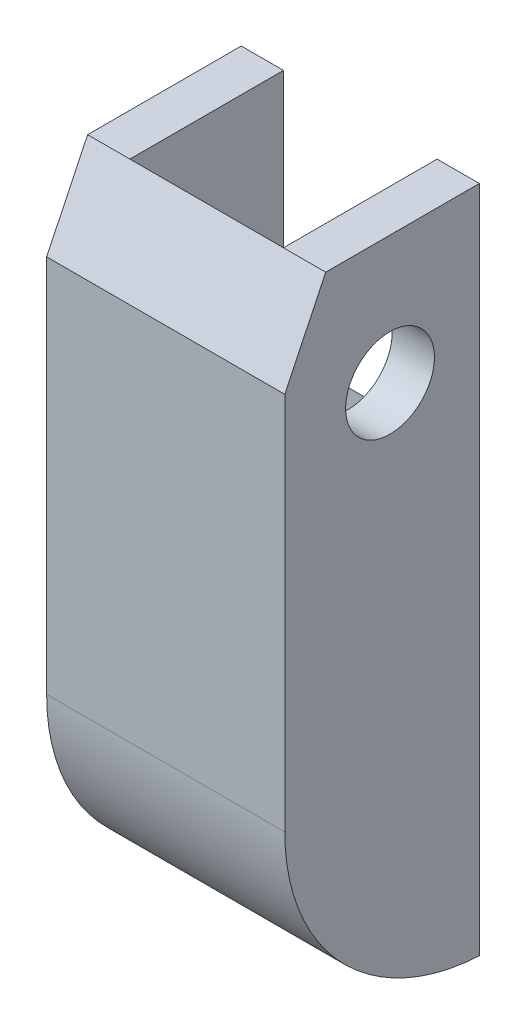
from build123d import *

# Parameters (mm, degrees)
SKETCH1_W               = 11.811
SKETCH1_H               = 45.98924
BOSS_EXTRUDE1_DEPTH     = 9.652
FILLET5_R               = 4.826
SKETCH2_W               = 7.62
SKETCH2_H               = 22.352
CUT_EXTRUDE1_DEPTH      = 7.62
CUT_EXTRUDE2_DEPTH      = 49.452771033
CUT_EXTRUDE2_DEPTH_BACK = 49.452771033
SKETCH3_R               = 2.20345
FILLET4_R               = 4.826
FILLET6_R               = 10.16
CUT_EXTRUDE3_DEPTH      = 49.452771033
CUT_EXTRUDE4_DEPTH      = 7.62
BOSS_EXTRUDE2_DEPTH     = 7.62


with BuildPart() as part:
    # Sketch1 → Boss-Extrude1 (new body)
    with BuildSketch(Plane.XY):
        with Locations((5.9055, 22.99462)):
            Rectangle(SKETCH1_W, SKETCH1_H)
    extrude(amount=BOSS_EXTRUDE1_DEPTH)

    # Fillet5
    fillet5_edges = [part.edges().sort_by_distance(p)[0] for p in [
        (5.9055, 45.98924, 0),
    ]]
    fillet(fillet5_edges, radius=FILLET5_R)

    # Sketch2 → Cut-Extrude1 (cut)
    with BuildSketch(Plane(origin=(0, 0, 0), x_dir=(-1, 0, 0), z_dir=(0, 0, -1))):
        with Locations((-5.9055, 34.81324)):
            Rectangle(SKETCH2_W, SKETCH2_H)
    extrude(amount=-CUT_EXTRUDE1_DEPTH, mode=Mode.SUBTRACT)

    # Sketch3 → Cut-Extrude2 (cut, two sides: drawn at the far end of the back side and taken through both)
    with BuildSketch(Plane.ZY.offset(-CUT_EXTRUDE2_DEPTH_BACK)):
        with Locations((4.4323, 26.82494)):
            Circle(SKETCH3_R)
    extrude(amount=CUT_EXTRUDE2_DEPTH + CUT_EXTRUDE2_DEPTH_BACK, mode=Mode.SUBTRACT)

    # Fillet4
    # the kernel refuses this fillet: 4.826 mm, written as the material it takes off along each edge
    with BuildSketch(Plane(origin=(23.876, 45.98924, 9.652), x_dir=(0, 0, -1), z_dir=(-1, 0, 0))) as fillet4_piece_1:
        with BuildLine():
            CenterArc((FILLET4_R, FILLET4_R), FILLET4_R, 180, 90)
            Line((0, FILLET4_R), (0, 0))
            Line((0, 0), (FILLET4_R, 0))
        make_face()
    extrude(amount=35.941, mode=Mode.SUBTRACT)

    # Fillet6
    # the kernel refuses this fillet: 10.16 mm, written as the material it takes off along each edge
    with BuildSketch(Plane(origin=(-25.368230131, 0, 9.652), x_dir=(0, 1, 0), z_dir=(1, 0, 0))) as fillet6_piece_1:
        with BuildLine():
            CenterArc((10.147292053, -10.16), FILLET6_R, 90, 87.134016017)
            Line((0, -9.652), (-0.202945841, -9.64184))
            ThreePointArc((-0.202945841, -9.64184), (-0.2032, -4.826), (-0.2032, 0))
            Line((-0.2032, 0), (0, 0.2032))
            Line((0, 0.2032), (10.147292053, 0.2032))
            Line((10.147292053, 0.2032), (10.147292053, 0))
        make_face()
    extrude(amount=62.547460263, mode=Mode.SUBTRACT)

    # Sketch4 → Cut-Extrude3 (cut, through all)
    with BuildSketch(Plane(origin=(11.811, 0, 0), x_dir=(0, 0, -1), z_dir=(1, 0, 0))):
        Polygon((-9.652, 28.943813088), (-7.62, 33.17494), (0, 33.17494), (0, 45.98924), (-9.652, 45.98924), align=None)
    extrude(amount=-CUT_EXTRUDE3_DEPTH, mode=Mode.SUBTRACT)

    # Sketch5 → Cut-Extrude4 (cut)
    with BuildSketch(Plane.ZY.offset(-9.7155)):
        Polygon((0, 21.160076085), (5.158068358, 23.63724), (0, 23.63724), align=None)
    extrude(amount=CUT_EXTRUDE4_DEPTH, mode=Mode.SUBTRACT)

    # Sketch5<3> → Boss-Extrude2 (add)
    with BuildSketch(Plane.ZY.offset(-9.7155)):
        with BuildLine():
            Line((5.812301369, 23.951435604), (5.158068358, 23.63724))
            Line((5.158068358, 23.63724), (7.62, 23.63724))
            Line((7.62, 23.63724), (7.62, 26.82494))
            ThreePointArc((7.62, 26.82494), (7.130490287, 25.127530072), (5.812301369, 23.951435604))
        make_face()
    extrude(amount=BOSS_EXTRUDE2_DEPTH)


solid = part.part
